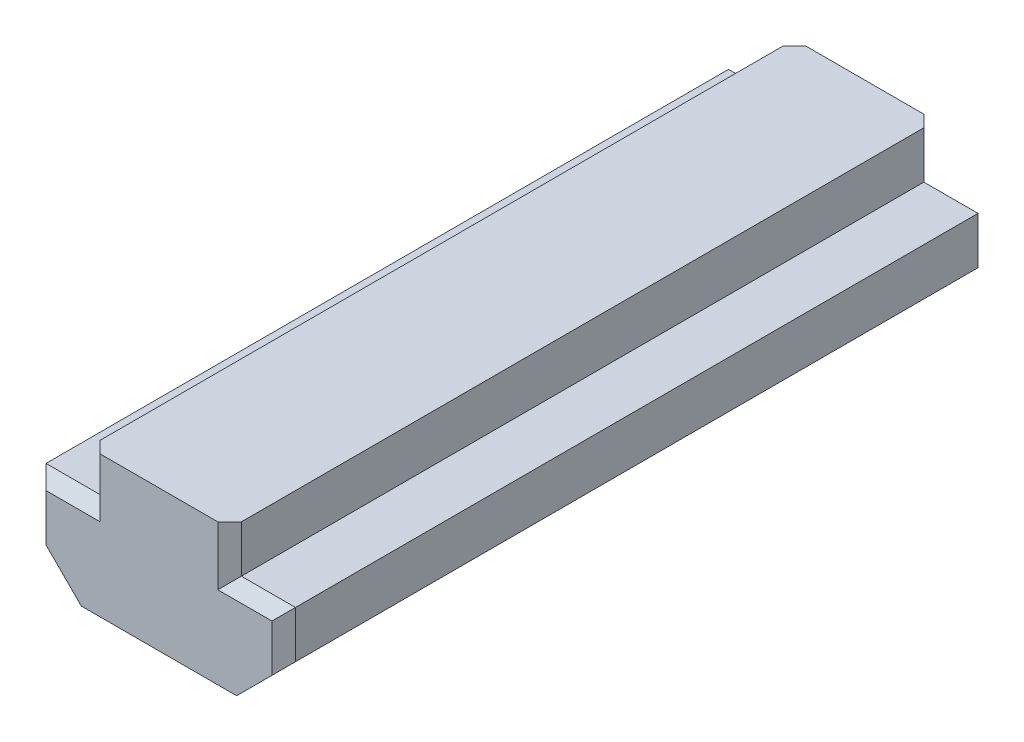
from build123d import *

# Parameters (mm, degrees)
EXTRUDE_1_DEPTH  = 15
CHAMFER_1_SIZE   = 2
CHAMFER_2_SIZE   = 0.5
MIRROR_START     = -8.660254038
MIRROR_2_DEPTH   = 2.193931023
MIRROR_START_2   = 6.466323015
MIRROR_2_2_DEPTH = 2.193931023


# Read off the part's stored shape, not the designer's step: 镜向2
with BuildPart() as part:
    # 草图1 → 凸台-拉伸1 (new, symmetric)
    with BuildSketch(Plane.XY):
        Polygon((-3, 0), (3, 0), (3, -2), (5.3, -2), (5.3, -6), (-5.3, -6), (-5.3, -2), (-3, -2), align=None)
    extrude(amount=EXTRUDE_1_DEPTH, both=True)

    # 倒角1
    chamfer_1_edges = [part.edges().sort_by_distance(p)[0] for p in [
        (5.3, -6, 0),
        (-5.3, -6, 0),
    ]]
    chamfer(chamfer_1_edges, length=CHAMFER_1_SIZE)

    # 倒角2
    chamfer_2_edges = [part.edges().sort_by_distance(p)[0] for p in [
        (-3, -1, 15),
        (-4.15, -2, 15),
        (-5.3, -3, 15),
        (5.3, -3, 15),
        (4.15, -2, 15),
        (3, -1, 15),
    ]]
    chamfer(chamfer_2_edges, length=CHAMFER_2_SIZE)

    # 镜向2 outline → 镜向2 (cut)
    with BuildSketch(Plane(origin=(0, 0, 0), x_dir=(0.8164965809277261, -0.4082482904638631, -0.4082482904638625), z_dir=(0.5773502691896255, 0.5773502691896263, 0.5773502691896255)).offset(MIRROR_START)):
        Polygon((9.185586535, 8.838834765), (11.063528672, 8.838834765), (11.880025252, 7.424621202), (12.702530685, 6), (13, 6), (13, 12), (7.360486936, 12), (8.164965809, 10.606601718), align=None)
    extrude(amount=MIRROR_2_DEPTH, mode=Mode.SUBTRACT)

    # Mirror 2 2 outline → Mirror 2 2 (cut)
    with BuildSketch(Plane(origin=(0, 0, 0), x_dir=(0.816496580927727, 0.4082482904638606, 0.4082482904638635), z_dir=(0.5773502691896244, -0.5773502691896244, -0.5773502691896285)).offset(MIRROR_START_2)):
        Polygon((-8.164965809, -10.606601718), (-9.185586535, -8.838834765), (-11.063528672, -8.838834765), (-11.880025252, -7.424621202), (-12.702530685, -6), (-13, -6), (-13, -12), (-7.360486936, -12), align=None)
    extrude(amount=MIRROR_2_2_DEPTH, mode=Mode.SUBTRACT)


solid = part.part
